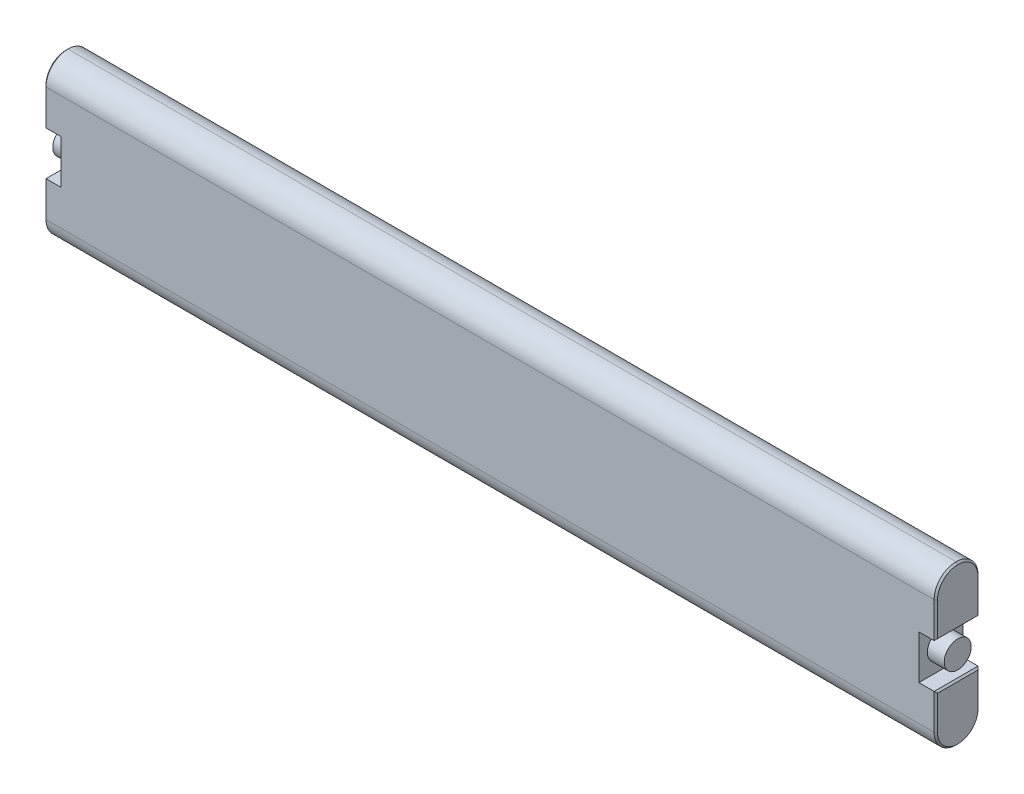
from build123d import *

# Parameters (mm, degrees)
BOSS_EXTRUDE1_DEPTH = 6.5
SKETCH2_R           = 2
BOSS_EXTRUDE2_DEPTH = 2.5
FILLET5_R           = 3.25
CHAMFER1_SIZE       = 0.25


with BuildPart() as part:
    # Sketch1 → Boss-Extrude1 (new body)
    with BuildSketch(Plane.XY):
        Polygon((0, -11.75), (-66, -11.75), (-66, -3.25), (-63.5, -3.25), (-63.5, 3.25), (-66, 3.25), (-66, 11.75), (0, 11.75), align=None)
    boss_extrude1 = extrude(amount=BOSS_EXTRUDE1_DEPTH)

    # Sketch2 → Boss-Extrude2 (add)
    with BuildSketch(Plane.ZY.offset(63.5)):
        with Locations(Location((3.25, 0, 0), (0, 0, 180))):
            Circle(SKETCH2_R)
    boss_extrude2 = extrude(amount=BOSS_EXTRUDE2_DEPTH)

    # Mirror1: Boss-Extrude1, Boss-Extrude2 across plane
    add(boss_extrude1.mirror(Plane(origin=(0, 0, 0), x_dir=(0, 0, 1), z_dir=(1, 0, 0))))
    add(boss_extrude2.mirror(Plane(origin=(0, 0, 0), x_dir=(0, 0, 1), z_dir=(1, 0, 0))))

    # Fillet5
    fillet5_edges = [part.edges().sort_by_distance(p)[0] for p in [
        (0, -11.75, 0),
        (0, -11.75, 6.5),
        (0, 11.75, 0),
        (0, 11.75, 6.5),
    ]]
    fillet(fillet5_edges, radius=FILLET5_R - 0.0001)  # a hair under: the kernel refuses the full size

    # Chamfer1
    chamfer1_edges = [part.edges().sort_by_distance(p)[0] for p in [
        (-66, -3.25, 3.25),
        (-66, 3.25, 3.25),
        (-66, -5.87505, 6.5),
        (66, -5.87505, 6.5),
        (66, -3.25, 3.25),
        (66, 3.25, 3.25),
        (66, -5.87505, 0),
        (66, -10.798126328, 5.548126328),
        (66, -10.798126328, 0.951873672),
        (66, 5.87505, 0),
        (-66, 5.87505, 0),
        (-66, -10.798126328, 5.548126328),
        (-66, -10.798126328, 0.951873672),
        (66, 5.87505, 6.5),
        (-66, 5.87505, 6.5),
        (-66, 10.798126328, 0.951873672),
        (-66, 10.798126328, 5.548126328),
        (66, 10.798126328, 0.951873672),
        (66, 10.798126328, 5.548126328),
        (-66, -5.87505, 0),
    ]]
    chamfer(chamfer1_edges, length=CHAMFER1_SIZE)


solid = part.part
